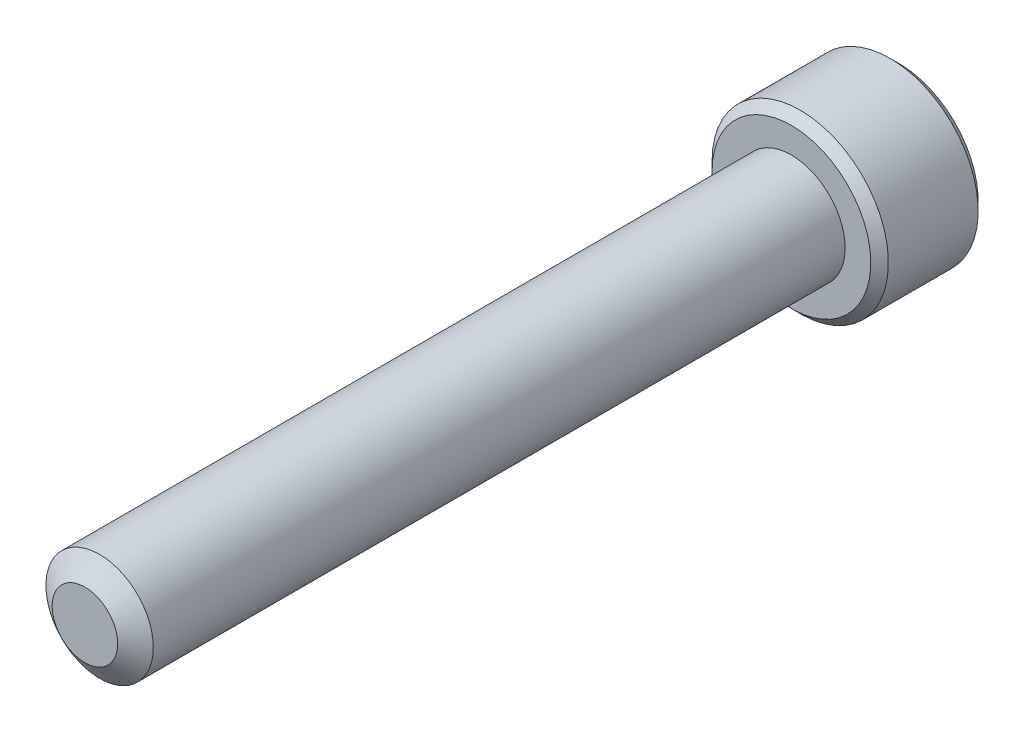
from build123d import *

# Parameters (mm, degrees)
SKETCH1_R          = 2.413
EXTRUDE1_DEPTH     = 31.75
SKETCH6_R          = 3.9624
EXTRUDE2_DEPTH     = 4.826
CUT_EXTRUDE1_DEPTH = 2.9765625
CHAMFER1_SIZE      = 0.39624


with BuildPart() as part:
    # Sketch1 → Extrude1 (new body)
    with BuildSketch(Plane.XY):
        Circle(SKETCH1_R)
    extrude(amount=-EXTRUDE1_DEPTH)

    # Sketch4 → Cut-Revolve1 (revolve, cut)
    with BuildSketch(Plane(origin=(0, 0, 0), x_dir=(0, 0, -1), z_dir=(1, 0, 0))):
        Polygon((0.659180743, 2.413), (0, 1.471592336), (0, 2.413), align=None)
    revolve(axis=Axis((0, 0, 0), (0, 0, -1)), mode=Mode.SUBTRACT)

    # Sketch6 → Extrude2 (add)
    with BuildSketch(Plane(origin=(0, 0, -31.75), x_dir=(-1, 0, 0), z_dir=(0, 0, -1))):
        Circle(SKETCH6_R)
    extrude(amount=EXTRUDE2_DEPTH)

    # Sketch7 → Cut-Extrude1 (cut)
    with BuildSketch(Plane(origin=(0, 0, -36.576), x_dir=(-1, 0, 0), z_dir=(0, 0, -1))):
        Polygon((0, 2.291358881), (-1.984375, 1.14567944), (-1.984375, -1.14567944), (0, -2.291358881), (1.984375, -1.14567944), (1.984375, 1.14567944), align=None)
    extrude(amount=-CUT_EXTRUDE1_DEPTH, mode=Mode.SUBTRACT)

    # Cut-Extrude2 cone 1 section (through the dimple's axis) → Cut-Extrude2 (revolve, cut)
    with BuildSketch(Plane(origin=(0, 0, -36.576), x_dir=(0, 1, 0), z_dir=(1, 0, 0))):
        Polygon((0, 0), (2.291358881, 0), (0, 2.291358881), align=None)
    revolve(axis=Axis((0, 0, -36.576), (0, 0, 1)), mode=Mode.SUBTRACT)

    # Chamfer1
    chamfer1_edges = [part.edges().sort_by_distance(p)[0] for p in [
        (3.9624, 0, -36.576),
        (3.9624, 0, -31.75),
    ]]
    chamfer(chamfer1_edges, length=CHAMFER1_SIZE)


solid = part.part
